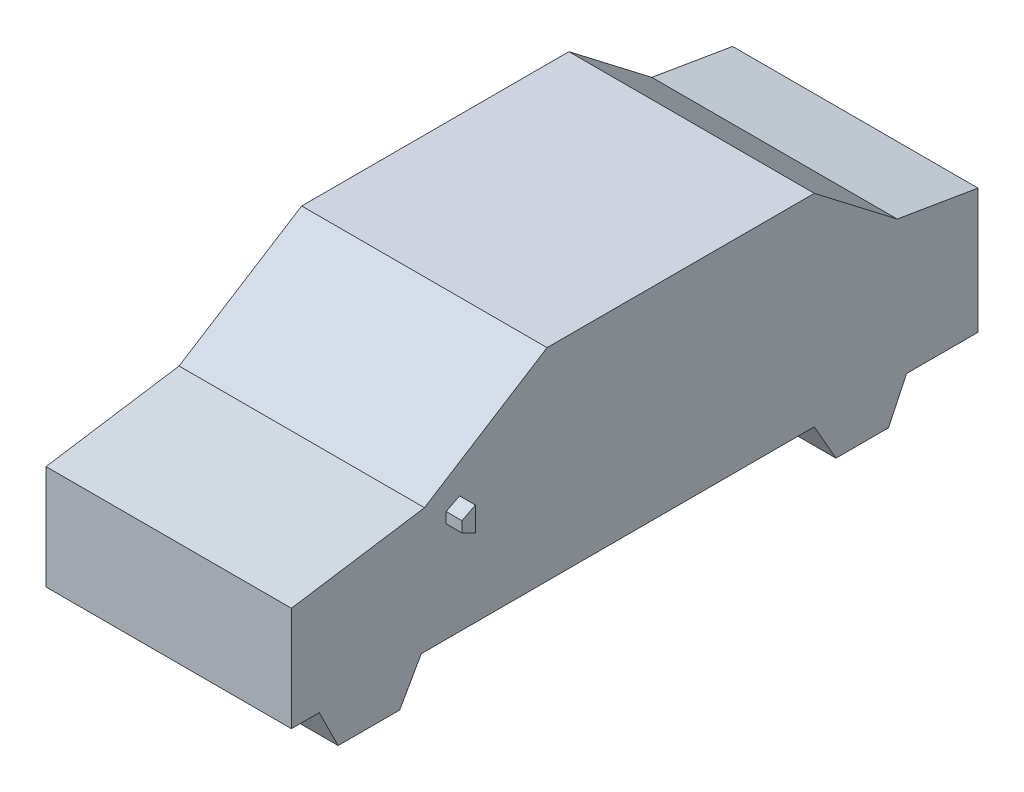
from build123d import *

# Parameters (mm, degrees)
EXTRUDE_1_DEPTH      = 1550
EXTRUDE_2_DEPTH      = 100
EXTRUDE_2_DEPTH_BACK = 1650


with BuildPart() as part:
    # Эскиз1 → Бобышка-Вытянуть1 (new body)
    with BuildSketch(Plane(origin=(0, 0, 0), x_dir=(0, 0, -1), z_dir=(1, 0, 0))):
        Polygon((0, 0), (0, 658.87563872), (840.441792245, 788.73141871), (1614.79322398, 1277), (3302.785099296, 1277), (3826.472113363, 874.659150999), (4336.637717029, 788.734761174), (4336.637717029, 0), (3886.057467004, 0), (3771.246676393, -240), (3439.453351147, -240), (3302.785099296, 0), (820.119296538, 0), (684.047248406, -240), (295.379400048, -240), (176.017340053, 0), align=None)
    extrude(amount=EXTRUDE_1_DEPTH)

    # Эскиз2 → Бобышка-Вытянуть2 (add, two sides: drawn at the far end of the back side and taken through both)
    with BuildSketch(Plane(origin=(1550, 0, 0), x_dir=(0, 0, -1), z_dir=(1, 0, 0)).offset(-EXTRUDE_2_DEPTH_BACK)):
        Polygon((977.680000946, 699.13622092), (977.680000946, 631.780006551), (1061.885264707, 590.645631586), (1061.885264707, 742.845049311), align=None)
    extrude(amount=EXTRUDE_2_DEPTH + EXTRUDE_2_DEPTH_BACK)


solid = part.part
